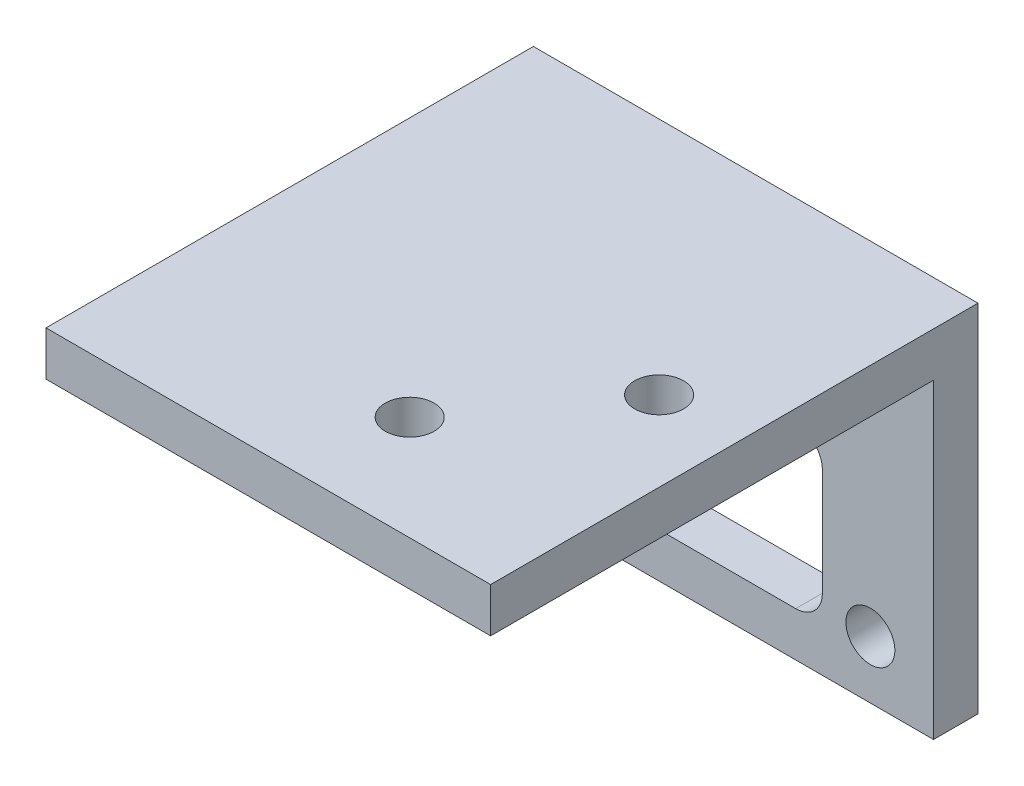
from build123d import *

# Parameters (mm, degrees)
SKETCH1_W           = 50
SKETCH1_H           = 40
SKETCH1_R           = 2.75
SKETCH1_W_2         = 25
SKETCH1_H_2         = 18
BOSS_EXTRUDE1_DEPTH = 5
SKETCH2_W           = 50
SKETCH2_H           = 5
BOSS_EXTRUDE2_DEPTH = 49.81
CUT_EXTRUDE1_REACH  = 84.031
SKETCH3_R           = 2.75
FILLET1_R           = 3


with BuildPart() as part:
    # Sketch1 → Boss-Extrude1 (new body)
    with BuildSketch(Plane.XY):
        with Locations((25, 20)):
            Rectangle(SKETCH1_W, SKETCH1_H)
        with Locations((7.1, 6.5)):
            Circle(SKETCH1_R, mode=Mode.SUBTRACT)
        with Locations((42.9, 6.5)):
            Circle(SKETCH1_R, mode=Mode.SUBTRACT)
        with Locations((15, 29.5)):
            Circle(SKETCH1_R, mode=Mode.SUBTRACT)
        with Locations((35, 29.5)):
            Circle(SKETCH1_R, mode=Mode.SUBTRACT)
        with Locations((25, 14)):
            Rectangle(SKETCH1_W_2, SKETCH1_H_2, mode=Mode.SUBTRACT)
    extrude(amount=BOSS_EXTRUDE1_DEPTH)

    # Sketch2 → Boss-Extrude2 (add)
    with BuildSketch(Plane.XY.offset(5)):
        with Locations((25, 37.5)):
            Rectangle(SKETCH2_W, SKETCH2_H)
    extrude(amount=BOSS_EXTRUDE2_DEPTH)

    # Sketch3 → Cut-Extrude1 (cut, up to next)
    with BuildSketch(Plane.XZ.offset(-35), mode=Mode.PRIVATE) as cut_extrude1_sk1:
        with Locations((29.15, 43.06)):
            Circle(SKETCH3_R)
    cut_extrude1_tool1 = extrude(cut_extrude1_sk1.sketch, amount=-CUT_EXTRUDE1_REACH, mode=Mode.PRIVATE) & part.part
    # Sketch3 → Cut-Extrude1 (cut, up to next)
    with BuildSketch(Plane.XZ.offset(-35), mode=Mode.PRIVATE) as cut_extrude1_sk2:
        with Locations((41, 26.86)):
            Circle(SKETCH3_R)
    cut_extrude1_tool2 = extrude(cut_extrude1_sk2.sketch, amount=-CUT_EXTRUDE1_REACH, mode=Mode.PRIVATE) & part.part
    add(cut_extrude1_tool1.solids().sort_by_distance((29.15, 35, 43.06))[0], mode=Mode.SUBTRACT)
    add(cut_extrude1_tool2.solids().sort_by_distance((41, 35, 26.86))[0], mode=Mode.SUBTRACT)

    # Fillet1
    fillet1_edges = [part.edges().sort_by_distance(p)[0] for p in [
        (37.5, 5, 2.5),
        (37.5, 23, 2.5),
        (12.5, 23, 2.5),
        (12.5, 5, 2.5),
    ]]
    fillet(fillet1_edges, radius=FILLET1_R)


solid = part.part
